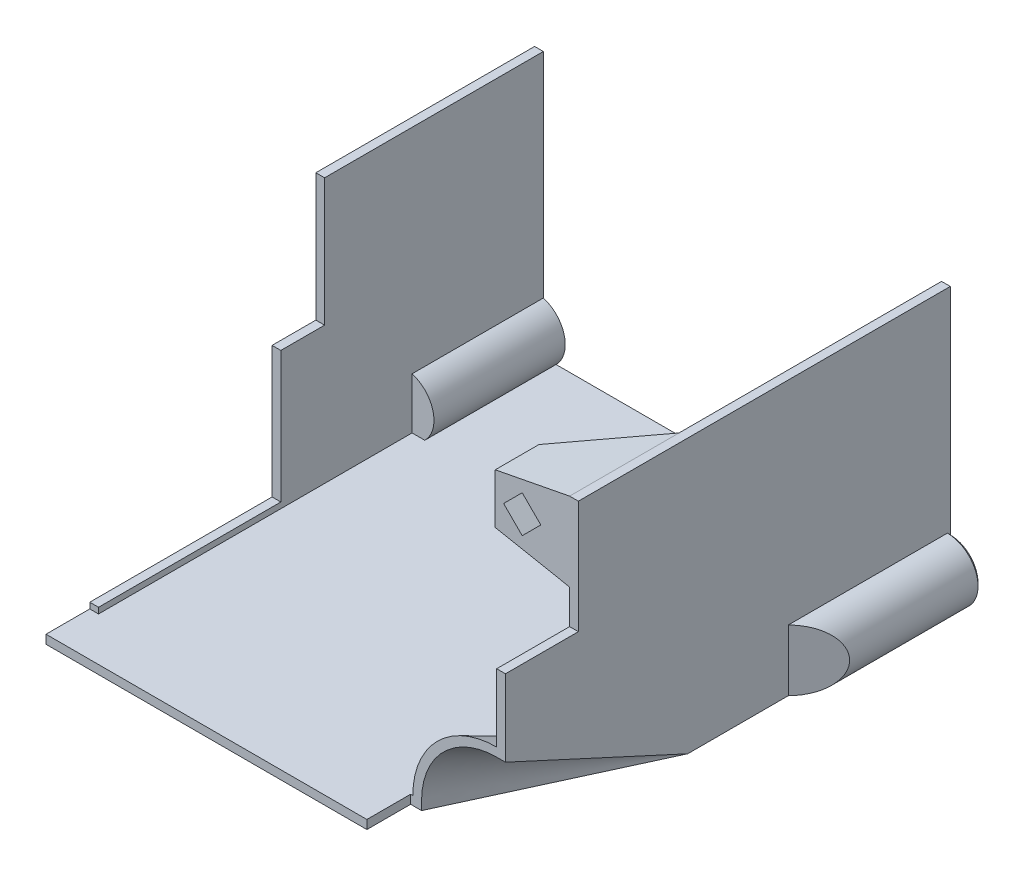
from build123d import *
from OCP.BRepFilletAPI import BRepFilletAPI_MakeChamfer

# Parameters (mm, degrees)
BOSS_EXTRUDE1_DEPTH            = 67
CUT_EXTRUDE1_DEPTH             = 6
CUT_EXTRUDE2_DEPTH             = 10
CUT_EXTRUDE2_DEPTH_BACK        = 10
SKETCH3_W                      = 57
SKETCH3_H                      = 15.5
SKETCH4_W                      = 1.200010082
SKETCH4_H                      = 17.5
CUT_EXTRUDE3_DEPTH             = 21
SKETCH6_R                      = 1.5
CUT_EXTRUDE4_DEPTH             = 16
SKETCH7_W                      = 9.665590287
SKETCH7_H                      = 8.4
SKETCH7_W_2                    = 5.868264521
SKETCH7_H_2                    = 7.024922359
SKETCH7_W_3                    = 9.177584355
SKETCH7_H_3                    = 13.349294629
SKETCH7_W_4                    = 6.831514048
SKETCH7_H_4                    = 12.149294629
CUT_EXTRUDE5_DEPTH             = 43
CHAMFER1_SIZE                  = 4.2
CHAMFER3_SIZE                  = 0.6
CHAMFER3_SIZE2                 = 0.346410162
CHAMFER4_SIZE                  = 0.4
BOSS_EXTRUDE2_DEPTH            = 15
CUT_EXTRUDE6_DEPTH             = 10
CUT_EXTRUDE6_DEPTH_BACK        = 9
CUT_EXTRUDE7_REACH             = 88.139
CUT_EXTRUDE7_DIRECTION_2_DEPTH = 10
SKETCH12_W                     = 1.2
SKETCH12_H                     = 25
CUT_EXTRUDE8_DEPTH             = 20


with BuildPart() as part:
    # Sketch1 → Boss-Extrude1 (new body)
    with BuildSketch(Plane.XY):
        with BuildLine():
            Line((-33.64746859, 16.547458508), (-34.84746859, 16.547458508))
            Line((-34.84746859, 16.547458508), (-34.84746859, -12.552541492))
            ThreePointArc((-34.84746859, -12.552541492), (-39.04746859, -16.752541492), (-34.84746859, -20.952541492))
            Line((-34.84746859, -20.952541492), (22.15253141, -20.952541492))
            ThreePointArc((22.15253141, -20.952541492), (26.35253141, -16.752541492), (22.15253141, -12.552541492))
            Line((22.15253141, -12.552541492), (22.15253141, 16.547458508))
            Line((22.15253141, 16.547458508), (20.95253141, 16.547458508))
            Line((20.95253141, 16.547458508), (20.95253141, -12.727619133))
            ThreePointArc((20.95253141, -12.727619133), (18.075643363, -15.743094195), (19.213143719, -19.752541492))
            Line((19.213143719, -19.752541492), (-31.908080898, -19.752541492))
            ThreePointArc((-31.908080898, -19.752541492), (-30.770580542, -15.743094195), (-33.64746859, -12.727619133))
            Line((-33.64746859, -12.727619133), (-33.64746859, 16.547458508))
        make_face()
    extrude(amount=BOSS_EXTRUDE1_DEPTH)

    # Sketch2 → Cut-Extrude1 (cut)
    with BuildSketch(Plane.XY.offset(67)):
        Polygon((9.15253141, -20.952541492), (32.878117539, -20.952541492), (32.878117539, 12.674112742), (-34.84746859, 12.674112742), (-34.84746859, -7.507472589), (-42.7406396, -7.507472589), (-42.7406396, -20.952541492), (-34.84746859, -20.952541492), (-34.84746859, -19.752541492), (9.15253141, -19.752541492), align=None)
    extrude(amount=-CUT_EXTRUDE1_DEPTH, mode=Mode.SUBTRACT)

    # Sketch3 → Cut-Extrude2 (cut, two sides: drawn at the far end of the back side and taken through both)
    with BuildSketch(Plane.XY.offset(61).offset(-CUT_EXTRUDE2_DEPTH_BACK)):
        with Locations((-6.34746859, 8.797458508)):
            Rectangle(SKETCH3_W, SKETCH3_H)
    extrude(amount=CUT_EXTRUDE2_DEPTH + CUT_EXTRUDE2_DEPTH_BACK, mode=Mode.SUBTRACT)

    # Sketch4 → Cut-Extrude3 (cut)
    with BuildSketch(Plane.XY.offset(51)):
        with Locations((-34.247463549, 7.797458508)):
            Rectangle(SKETCH4_W, SKETCH4_H)
    extrude(amount=-CUT_EXTRUDE3_DEPTH, mode=Mode.SUBTRACT)

    # Sketch6 → Cut-Extrude4 (cut)
    with BuildSketch(Plane(origin=(0, 0, 0), x_dir=(-1, 0, 0), z_dir=(0, 0, -1))):
        with Locations((-22.15253141, -16.752541492)):
            Circle(SKETCH6_R)
        with Locations((34.84746859, -16.752541492)):
            Circle(SKETCH6_R)
    extrude(amount=-CUT_EXTRUDE4_DEPTH, mode=Mode.SUBTRACT)

    # Sketch7 → Cut-Extrude5 (cut)
    with BuildSketch(Plane.XY.offset(61)):
        with Locations((26.985326554, -16.752541492)):
            Rectangle(SKETCH7_W, SKETCH7_H)
        with Locations((18.01839915, -16.240080313)):
            Rectangle(SKETCH7_W_2, SKETCH7_H_2)
        with Locations((-39.436260768, -14.277894178)):
            Rectangle(SKETCH7_W_3, SKETCH7_H_3)
        with Locations((-30.231711566, -13.677894178)):
            Rectangle(SKETCH7_W_4, SKETCH7_H_4)
    extrude(amount=-CUT_EXTRUDE5_DEPTH, mode=Mode.SUBTRACT)

    # Chamfer1
    # the kernel refuses this chamfer: 4.2 mm, written as the material it adds along each edge
    with BuildSketch(Plane(origin=(22.15253141, -31.753610042, 18), x_dir=(0.9996219169112966, 0, -0.02749587661058613), z_dir=(0, 1, 0))) as chamfer1_piece_1_section:
        Polygon((CHAMFER1_SIZE * 0.999621916911, -CHAMFER1_SIZE * 0.0274958766106), (-CHAMFER1_SIZE * 0.0274958766106, -CHAMFER1_SIZE * 0.999621916911), (0, 0), align=None)
    chamfer1_piece_1 = extrude(amount=30.002137099, mode=Mode.PRIVATE)
    chamfer1_piece_1 = chamfer1_piece_1 & Plane(origin=(22.15253141, -16.752541492, 19.463662148), x_dir=(0, -1, 0), z_dir=(0, 0, -1)) * Cylinder(4.2, 77, mode=Mode.PRIVATE)
    add(chamfer1_piece_1)
    with BuildSketch(Plane(origin=(-34.84746859, -1.751472943, 18), x_dir=(-0.9996219169112966, 0, -0.02749587661058611), z_dir=(0, -1, 0))) as chamfer1_piece_2_section:
        Polygon((CHAMFER1_SIZE * 0.999621916911, -CHAMFER1_SIZE * 0.0274958766106), (-CHAMFER1_SIZE * 0.0274958766106, -CHAMFER1_SIZE * 0.999621916911), (0, 0), align=None)
    chamfer1_piece_2 = extrude(amount=30.002137099, mode=Mode.PRIVATE)
    chamfer1_piece_2 = chamfer1_piece_2 & Plane(origin=(-34.84746859, -16.752541492, 19.463662148), x_dir=(0, 1, 0), z_dir=(0, 0, -1)) * Cylinder(4.2, 77, mode=Mode.PRIVATE)
    add(chamfer1_piece_2)

    # Chamfer3: one chamfer whose edges measure the first distance from different faces: ONE call of the kernel's chamfer builder (chamfer() names one face for all edges)
    chamfer3_edges_1 = [part.edges().sort_by_distance(p)[0] for p in [
        (23.65253141, -16.752541492, 0),
    ]]
    chamfer3_side_1 = [part.faces().sort_by_distance(p)[0] for p in [
        (23.65253141, -16.752541492, 8),
    ]]
    chamfer3_edges_2 = [part.edges().sort_by_distance(p)[0] for p in [
        (-33.34746859, -16.752541492, 0),
    ]]
    chamfer3_side_2 = [part.faces().sort_by_distance(p)[0] for p in [
        (-33.34746859, -16.752541492, 8),
    ]]
    chamfer3 = BRepFilletAPI_MakeChamfer(part.part.solid().wrapped)
    for e in chamfer3_edges_1:
        chamfer3.Add(CHAMFER3_SIZE, CHAMFER3_SIZE2, e.wrapped, chamfer3_side_1[0].wrapped)  # the first distance lies on this face
    for e in chamfer3_edges_2:
        chamfer3.Add(CHAMFER3_SIZE, CHAMFER3_SIZE2, e.wrapped, chamfer3_side_2[0].wrapped)  # the first distance lies on this face
    add(Compound.cast(chamfer3.Shape()), mode=Mode.REPLACE)

    # Chamfer4
    chamfer4_edges = [part.edges().sort_by_distance(p)[0] for p in [
        (26.35253141, -16.752541492, 0),
        (-6.34746859, -20.952541492, 0),
        (-39.04746859, -16.752541492, 0),
    ]]
    chamfer(chamfer4_edges, length=CHAMFER4_SIZE)

    # Sketch8 → Boss-Extrude2 (add)
    with BuildSketch(Plane.XY.offset(51)):
        Polygon((10.75253141, 14.572458508), (10.75253141, 12.747458508), (10.75253141, 9.547458508), (10.75253141, 7.722458508), (20.95253141, 5.747458508), (22.15253141, 5.747458508), (22.15253141, 16.547458508), (20.95253141, 16.547458508), align=None)
        Polygon((11.90253141, 11.147458508), (14.45253141, 13.697458508), (17.00253141, 11.147458508), (14.45253141, 8.597458508), align=None, mode=Mode.SUBTRACT)
    extrude(amount=-BOSS_EXTRUDE2_DEPTH)

    # Sketch10 → Cut-Extrude6 (cut, two sides: drawn at the far end of the back side and taken through both)
    with BuildSketch(Plane(origin=(0, 0, 36), x_dir=(-1, 0, 0), z_dir=(0, 0, -1)).offset(-CUT_EXTRUDE6_DEPTH_BACK)):
        with BuildLine():
            Line((-14.45253141, 14.147458508), (-10.75253141, 14.147458508))
            Line((-10.75253141, 14.147458508), (-10.75253141, 8.147458508))
            Line((-10.75253141, 8.147458508), (-14.45253141, 8.147458508))
            ThreePointArc((-14.45253141, 8.147458508), (-17.45253141, 11.147458508), (-14.45253141, 14.147458508))
        make_face()
    extrude(amount=CUT_EXTRUDE6_DEPTH + CUT_EXTRUDE6_DEPTH_BACK, mode=Mode.SUBTRACT)

    # Cut-Extrude7: up to this plane
    cut_extrude7_end = Plane(origin=(20.95253141, 5.747458508, 36), z_dir=(-0.19009672538975653, -0.9817653665698803, 0))
    # Sketch11 → Cut-Extrude7 (cut, up to the surface)
    with BuildSketch(Plane(origin=(0, 16.547458508, 0), x_dir=(1, 0, 0), z_dir=(0, 1, 0)), mode=Mode.PRIVATE) as cut_extrude7_sk1:
        Polygon((20.95253141, -36), (10.75253141, -45), (10.75253141, -36), align=None)
    cut_extrude7_tool1 = split(extrude(cut_extrude7_sk1.sketch, amount=-CUT_EXTRUDE7_REACH, mode=Mode.PRIVATE), bisect_by=cut_extrude7_end, keep=Keep.BOTH, mode=Mode.PRIVATE)
    add(cut_extrude7_tool1.solids().sort_by_distance((14.152531, 16.547459, 39))[0], mode=Mode.SUBTRACT)

    # Sketch11 → Cut-Extrude7 direction 2 (cut)
    with BuildSketch(Plane(origin=(0, 16.547458508, 0), x_dir=(1, 0, 0), z_dir=(0, 1, 0))):
        Polygon((20.95253141, -36), (10.75253141, -45), (10.75253141, -36), align=None)
    extrude(amount=CUT_EXTRUDE7_DIRECTION_2_DEPTH, mode=Mode.SUBTRACT)

    # Sketch12 → Cut-Extrude8 (cut)
    with BuildSketch(Plane(origin=(0, 1.047458508, 0), x_dir=(1, 0, 0), z_dir=(0, 1, 0))):
        with Locations((-34.24746859, -48.5)):
            Rectangle(SKETCH12_W, SKETCH12_H)
    extrude(amount=-CUT_EXTRUDE8_DEPTH, mode=Mode.SUBTRACT)

    # Sketch13 → Loft1 section 0
    with BuildSketch(Plane.XY.offset(61), mode=Mode.PRIVATE) as loft1_s0:
        with BuildLine():
            Line((9.45253141, -19.752541492), (20.95253141, -19.752541492))
            Line((20.95253141, -19.752541492), (20.95253141, -8.252541492))
            ThreePointArc((20.95253141, -8.252541492), (12.820803427, -11.620813508), (9.45253141, -19.752541492))
        make_face()
    loft([loft1_s0.sketch, Vertex(20.95253141, -19.752541492, 36)])

    # Sketch15 → Cut-Loft1 section 0
    with BuildSketch(Plane.XY.offset(61), mode=Mode.PRIVATE) as cut_loft1_s0:
        with BuildLine():
            Line((20.95253141, -9.452541492), (22.15253141, -9.452541492))
            Line((22.15253141, -9.452541492), (22.15253141, -20.952541492))
            Line((22.15253141, -20.952541492), (10.65253141, -20.952541492))
            Line((10.65253141, -20.952541492), (10.65253141, -19.752541492))
            ThreePointArc((10.65253141, -19.752541492), (13.669331564, -12.469341646), (20.95253141, -9.452541492))
        make_face()
    loft([cut_loft1_s0.sketch, Vertex(22.15253141, -20.952541492, 36)], mode=Mode.SUBTRACT)


solid = part.part
